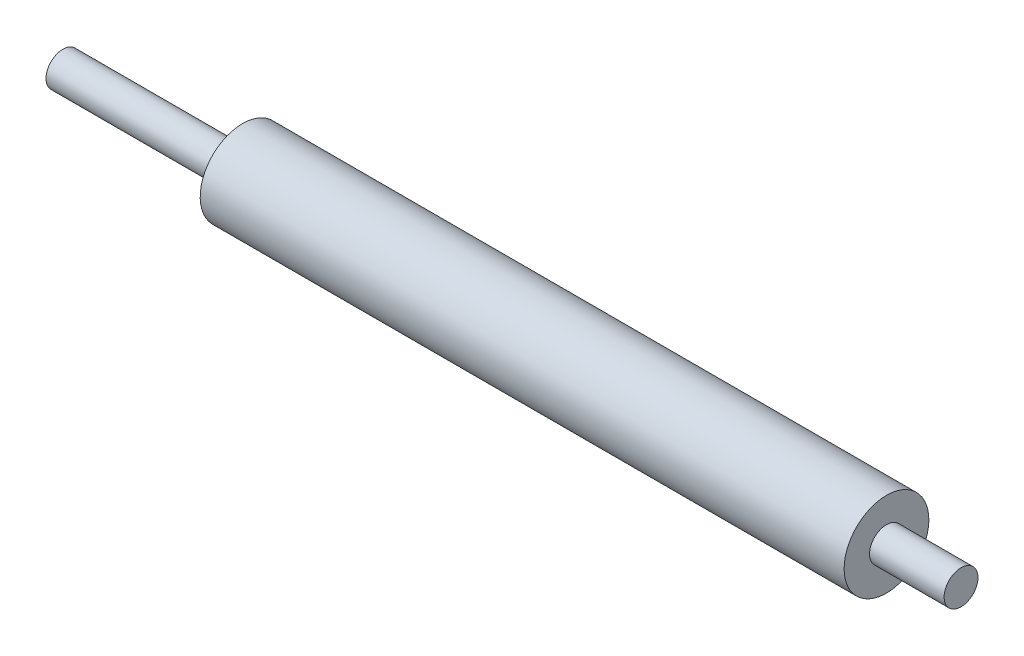
from build123d import *


with BuildPart() as part:
    # Sketch2 → Revolve1 (revolve)
    with BuildSketch(Plane.XY):
        Polygon((0, 0), (0, 5), (53, 5), (53, 12.5), (243, 12.5), (243, 5), (265, 5), (265, 0), align=None)
    revolve(axis=Axis((265, 0, 0), (-1, 0, 0)))


solid = part.part
